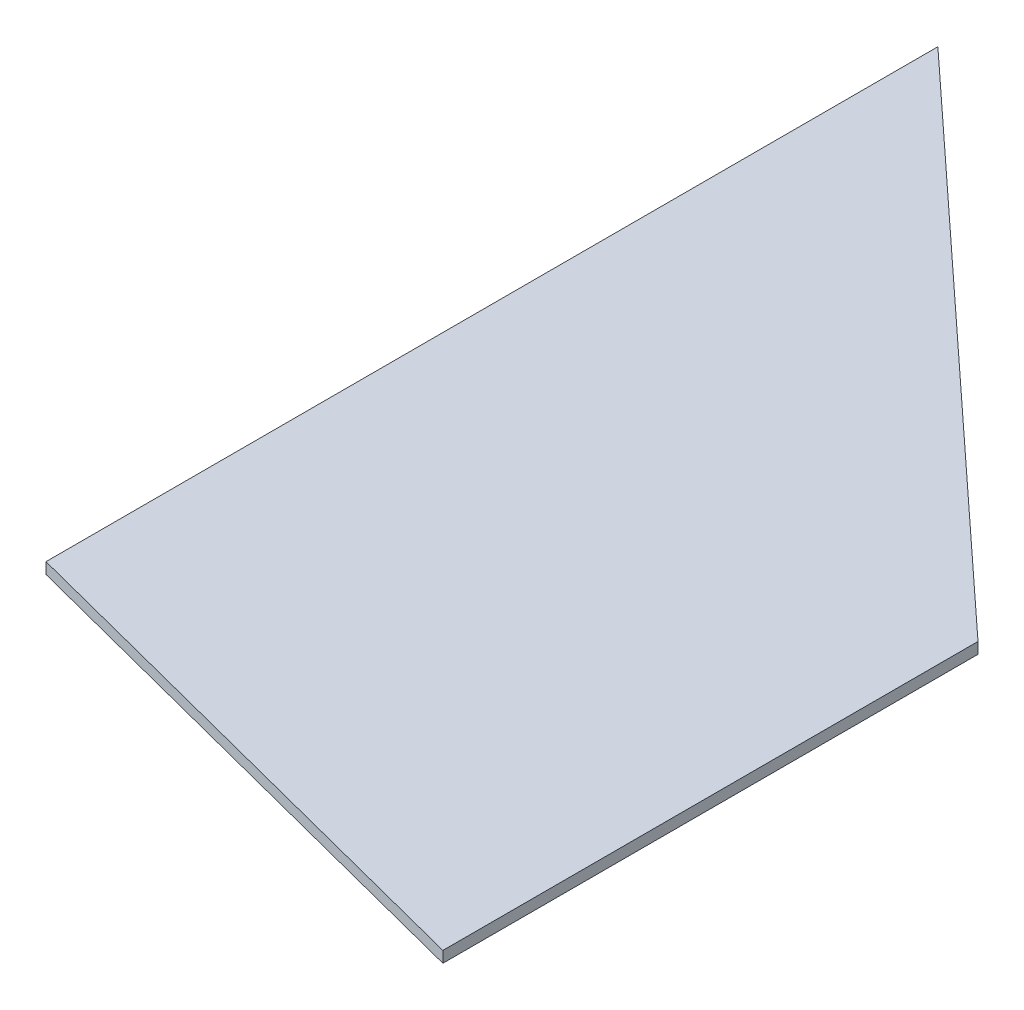
from build123d import *

# Parameters (mm, degrees)
BOSS_EXTRUDE1_DEPTH = 3.175


with BuildPart() as part:
    # Sketch1 → Boss-Extrude1 (new body)
    with BuildSketch(Plane(origin=(0, 0, 0), x_dir=(1, 0, 0), z_dir=(0, 1, 0))):
        Polygon((0, 0), (0, 254), (152.4, 113.03), (152.4, -39.37), align=None)
    extrude(amount=BOSS_EXTRUDE1_DEPTH)


solid = part.part
